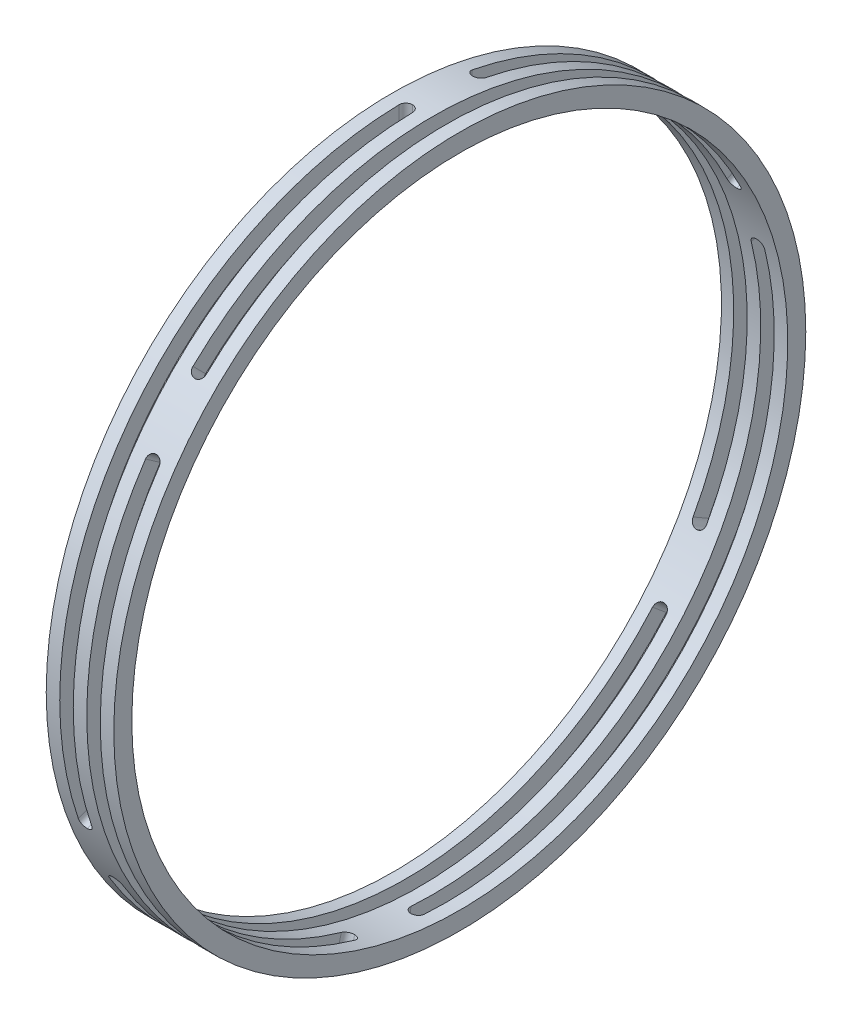
from build123d import *

# Parameters (mm, degrees)
SKICA3_W                   = 1.5
SKICA3_H                   = 2
ODEBRAT_ROTAC_1_ANGLE      = 110
ZAOBLIT1_R                 = 0.75
KRUHOV_POLE1_COUNT         = 3
ZAOBLIT1_OF_KRUHOV_POLE1_R = 0.75
SKICA5_W                   = 1.5
SKICA5_H                   = 2
ODEBRAT_ROTAC_2_ANGLE      = 110
ZAOBLIT3_R                 = 0.75
KRUHOV_POLE2_COUNT         = 3
ZAOBLIT3_OF_KRUHOV_POLE2_R = 0.75


with BuildPart() as part:
    # Skica1 → Rotovat1 (revolve)
    with BuildSketch(Plane.XY, mode=Mode.PRIVATE) as rotovat1_sk:
        Polygon((0, 38.4), (0.139853624, 36.4), (7.5, 36.4), (7.5, 38.4), align=None)
    revolve(rotovat1_sk.sketch.rotate(Axis((0, 0, 0), (1, 0, 0)), 90), axis=Axis((0, 0, 0), (1, 0, 0)))

    # Skica3 → Odebrat rotací1 (revolve, cut)
    with BuildSketch(Plane.XY):
        with Locations((2.25, 37.4)):
            Rectangle(SKICA3_W, SKICA3_H)
    odebrat_rotac_1 = revolve(axis=Axis((0, 0, 0), (1, 0, 0)), revolution_arc=ODEBRAT_ROTAC_1_ANGLE, mode=Mode.SUBTRACT)

    # Zaoblit1
    zaoblit1_edges = [part.edges().sort_by_distance(p)[0] for p in [
        (3, -12.79155336, 35.144504017),
        (1.5, -12.79155336, 35.144504017),
        (1.5, 37.4, 0),
        (3, 37.4, 0),
    ]]
    fillet(zaoblit1_edges, radius=ZAOBLIT1_R - 0.0001)  # a hair under: the kernel refuses the full size

    # Kruhové pole1: Odebrat rotací1 ×3 about axis
    kruhov_pole1_axis = Axis((0, 0, 0), (1, 0, 0))
    for i in range(1, KRUHOV_POLE1_COUNT):
        add(odebrat_rotac_1.rotate(kruhov_pole1_axis, i * 360 / KRUHOV_POLE1_COUNT), mode=Mode.SUBTRACT)

    # Zaoblit1 of Kruhové pole1
    zaoblit1_of_kruhov_pole1_edges = [part.edges().sort_by_distance(p)[0] for p in [
        (3, -24.040256602, -28.650062173),
        (1.5, -24.040256602, -28.650062173),
        (1.5, -18.7, 32.389350102),
        (3, -18.7, 32.389350102),
        (3, 36.831809963, -6.494441845),
        (1.5, 36.831809963, -6.494441845),
        (1.5, -18.7, -32.389350102),
        (3, -18.7, -32.389350102),
    ]]
    fillet(zaoblit1_of_kruhov_pole1_edges, radius=ZAOBLIT1_OF_KRUHOV_POLE1_R - 0.0001)  # a hair under: the kernel refuses the full size

    # Skica5 → Odebrat rotací2 (revolve, cut)
    with BuildSketch(Plane(origin=(0, 0, 0), x_dir=(1, 0, 0), z_dir=(0, -0.819152044288993, 0.5735764363510444))):
        with Locations((5.25, 37.4)):
            Rectangle(SKICA5_W, SKICA5_H)
    odebrat_rotac_2 = revolve(axis=Axis((0, 0, 0), (1, 0, 0)), revolution_arc=ODEBRAT_ROTAC_2_ANGLE, mode=Mode.SUBTRACT)

    # Zaoblit3
    zaoblit3_edges = [part.edges().sort_by_distance(p)[0] for p in [
        (4.5, 21.45175872, 30.636286456),
        (6, 21.45175872, 30.636286456),
        (6, -36.125625903, 9.679832287),
        (4.5, -36.125625903, 9.679832287),
    ]]
    fillet(zaoblit3_edges, radius=ZAOBLIT3_R - 0.0001)  # a hair under: the kernel refuses the full size

    # Kruhové pole2: Odebrat rotací2 ×3 about axis
    kruhov_pole2_axis = Axis((0, 0, 0), (1, 0, 0))
    for i in range(1, KRUHOV_POLE2_COUNT):
        add(odebrat_rotac_2.rotate(kruhov_pole2_axis, i * 360 / KRUHOV_POLE2_COUNT), mode=Mode.SUBTRACT)

    # Zaoblit3 of Kruhové pole2
    zaoblit3_of_kruhov_pole2_edges = [part.edges().sort_by_distance(p)[0] for p in [
        (4.5, -37.257681709, 3.259624779),
        (6, -37.257681709, 3.259624779),
        (6, 9.679832287, -36.125625903),
        (4.5, 9.679832287, -36.125625903),
        (4.5, 15.805922989, -33.895911235),
        (6, 15.805922989, -33.895911235),
        (6, 26.445793616, 26.445793616),
        (4.5, 26.445793616, 26.445793616),
    ]]
    fillet(zaoblit3_of_kruhov_pole2_edges, radius=ZAOBLIT3_OF_KRUHOV_POLE2_R - 0.0001)  # a hair under: the kernel refuses the full size


solid = part.part
